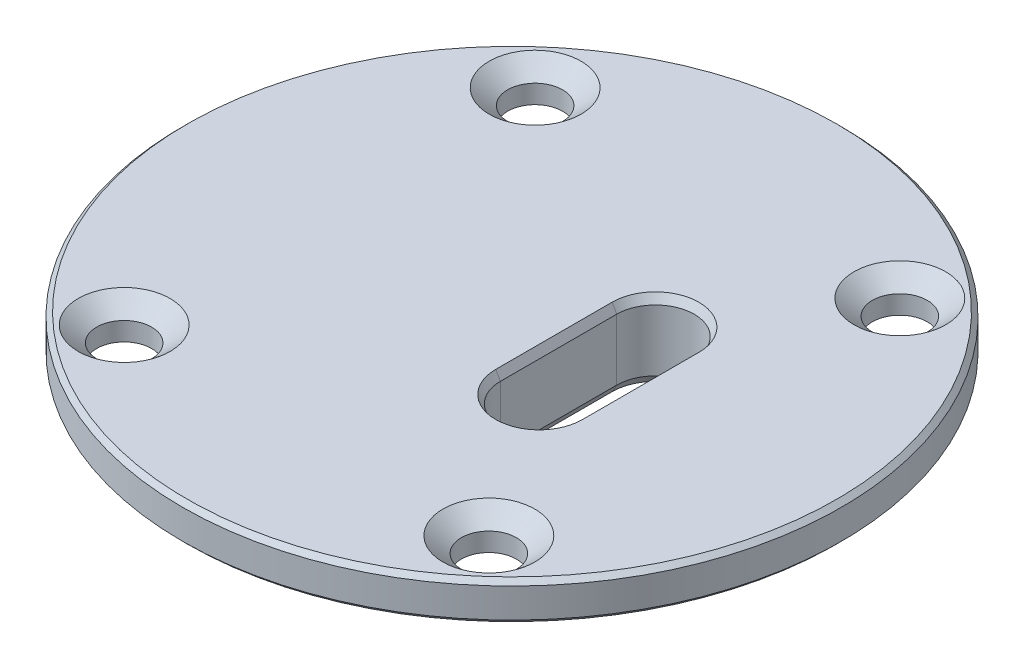
from build123d import *
from OCP.BRepFilletAPI import BRepFilletAPI_MakeChamfer

# Parameters (mm, degrees)
STOCK_DGT_START                               = 66.675
STOCK_DGT_INSIDE_SWERVE_STRUCTURE_SM_2_R      = 26.9875
STOCK_DGT_INSIDE_SWERVE_STRUCTURE_SM_2_R_2    = 2.2479
STOCK_DGT_INSIDE_SWERVE_STRUCTURE_SMALL_DEPTH = 3.175
STOCK_DGT_START_2                             = 63.5
STOCK_DGT_INSIDE_SWERVE_STRUCTURE_SM_3_O_R    = 15.875
STOCK_DGT_INSIDE_SWERVE_STRUCTURE_SM_3_DEPTH  = 3.175
SKETCH1_R                                     = 15.875
SKETCH1_R_2                                   = 15.621
CUT_EXTRUDE1_DEPTH                            = 3.175
FILLET1_R                                     = 0.635
CHAMFER1_SIZE                                 = 0.381
CHAMFER2_SIZE                                 = 0.381
CHAMFER2_SIZE2                                = 0.659911358
CHAMFER3_SIZE                                 = 1.27
CHAMFER3_SIZE2                                = 1.513527063


# Read off the part's stored shape, not the designer's step: Stock-DGT inside swerve structure Small Bearing-1
with BuildPart() as part:
    # Stock-DGT inside swerve structure Sm 2 → Stock-DGT inside swerve structure Small Bearing-1 (new body)
    with BuildSketch(Plane(origin=(0, 0, 0), x_dir=(1, 0, 0), z_dir=(0, 1, 0)).offset(STOCK_DGT_START)):
        Circle(STOCK_DGT_INSIDE_SWERVE_STRUCTURE_SM_2_R)
        with Locations((-14.933176064, -16.8275)):
            Circle(STOCK_DGT_INSIDE_SWERVE_STRUCTURE_SM_2_R_2, mode=Mode.SUBTRACT)
        with Locations((14.933176064, -16.8275)):
            Circle(STOCK_DGT_INSIDE_SWERVE_STRUCTURE_SM_2_R_2, mode=Mode.SUBTRACT)
        with Locations((-14.933176064, 16.8275)):
            Circle(STOCK_DGT_INSIDE_SWERVE_STRUCTURE_SM_2_R_2, mode=Mode.SUBTRACT)
        with Locations((14.933176064, 16.8275)):
            Circle(STOCK_DGT_INSIDE_SWERVE_STRUCTURE_SM_2_R_2, mode=Mode.SUBTRACT)
        with BuildLine():
            Line((3.81, -4.7625), (3.81, 4.7625))
            ThreePointArc((3.81, 4.7625), (6.985, 7.9375), (10.16, 4.7625))
            Line((10.16, 4.7625), (10.16, -4.7625))
            ThreePointArc((10.16, -4.7625), (6.985, -7.9375), (3.81, -4.7625))
        make_face(mode=Mode.SUBTRACT)
    extrude(amount=STOCK_DGT_INSIDE_SWERVE_STRUCTURE_SMALL_DEPTH)

    # Stock-DGT inside swerve structure Sm 3 o → Stock-DGT inside swerve structure Sm 3 (add)
    with BuildSketch(Plane(origin=(0, 0, 0), x_dir=(1, 0, 0), z_dir=(0, 1, 0)).offset(STOCK_DGT_START_2)):
        Circle(STOCK_DGT_INSIDE_SWERVE_STRUCTURE_SM_3_O_R)
        with BuildLine():
            ThreePointArc((10.16, -4.7625), (6.985, -7.9375), (3.81, -4.7625))
            Line((3.81, -4.7625), (3.81, 4.7625))
            ThreePointArc((3.81, 4.7625), (6.985, 7.9375), (10.16, 4.7625))
            Line((10.16, 4.7625), (10.16, -4.7625))
        make_face(mode=Mode.SUBTRACT)
    extrude(amount=STOCK_DGT_INSIDE_SWERVE_STRUCTURE_SM_3_DEPTH)

    # Sketch1 → Cut-Extrude1 (cut)
    with BuildSketch(Plane.XZ.offset(-63.5)):
        Circle(SKETCH1_R)
        with Locations(Location((0, 0, 0), (0, 0, 270))):
            Circle(SKETCH1_R_2, mode=Mode.SUBTRACT)
    extrude(amount=-CUT_EXTRUDE1_DEPTH, mode=Mode.SUBTRACT)

    # Fillet1
    fillet1_edges = [part.edges().sort_by_distance(p)[0] for p in [
        (0, 66.675, 15.621),
    ]]
    fillet(fillet1_edges, radius=FILLET1_R)

    # Chamfer1
    chamfer1_edges = [part.edges().sort_by_distance(p)[0] for p in [
        (-26.9875, 66.675, 0),
        (-26.9875, 69.85, 0),
        (0, 63.5, 15.621),
    ]]
    chamfer(chamfer1_edges, length=CHAMFER1_SIZE)

    # Chamfer2: one chamfer whose edges measure the first distance from different faces: ONE call of the kernel's chamfer builder (chamfer() names one face for all edges)
    chamfer2_edges_1 = [part.edges().sort_by_distance(p)[0] for p in [
        (-17.181076064, 66.675, -16.8275),
    ]]
    chamfer2_side_1 = [part.faces().sort_by_distance(p)[0] for p in [
        (-17.181076064, 68.2625, -16.8275),
    ]]
    chamfer2_edges_2 = [part.edges().sort_by_distance(p)[0] for p in [
        (-17.181076064, 66.675, 16.8275),
    ]]
    chamfer2_side_2 = [part.faces().sort_by_distance(p)[0] for p in [
        (-17.181076064, 68.2625, 16.8275),
    ]]
    chamfer2_edges_3 = [part.edges().sort_by_distance(p)[0] for p in [
        (10.16, 63.5, 0),
        (6.985, 63.5, -7.9375),
        (3.81, 63.5, 0),
        (6.985, 63.5, 7.9375),
    ]]
    chamfer2_side_3 = [part.faces().sort_by_distance(p)[0] for p in [
        (-1.009698226, 63.5, 0),
    ]]
    chamfer2_edges_4 = [part.edges().sort_by_distance(p)[0] for p in [
        (6.985, 69.85, 7.9375),
        (10.16, 69.85, 0),
        (6.985, 69.85, -7.9375),
        (3.81, 69.85, 0),
    ]]
    chamfer2_side_4 = [part.faces().sort_by_distance(p)[0] for p in [
        (-0.311216165, 69.85, 0),
    ]]
    chamfer2_edges_5 = [part.edges().sort_by_distance(p)[0] for p in [
        (12.685276064, 66.675, 16.8275),
    ]]
    chamfer2_side_5 = [part.faces().sort_by_distance(p)[0] for p in [
        (12.685276064, 68.2625, 16.8275),
    ]]
    chamfer2_edges_6 = [part.edges().sort_by_distance(p)[0] for p in [
        (12.685276064, 66.675, -16.8275),
    ]]
    chamfer2_side_6 = [part.faces().sort_by_distance(p)[0] for p in [
        (12.685276064, 68.2625, -16.8275),
    ]]
    chamfer2 = BRepFilletAPI_MakeChamfer(part.part.solid().wrapped)
    for e in chamfer2_edges_1:
        chamfer2.Add(CHAMFER2_SIZE, CHAMFER2_SIZE2, e.wrapped, chamfer2_side_1[0].wrapped)  # the first distance lies on this face
    for e in chamfer2_edges_2:
        chamfer2.Add(CHAMFER2_SIZE, CHAMFER2_SIZE2, e.wrapped, chamfer2_side_2[0].wrapped)  # the first distance lies on this face
    for e in chamfer2_edges_3:
        chamfer2.Add(CHAMFER2_SIZE, CHAMFER2_SIZE2, e.wrapped, chamfer2_side_3[0].wrapped)  # the first distance lies on this face
    for e in chamfer2_edges_4:
        chamfer2.Add(CHAMFER2_SIZE, CHAMFER2_SIZE2, e.wrapped, chamfer2_side_4[0].wrapped)  # the first distance lies on this face
    for e in chamfer2_edges_5:
        chamfer2.Add(CHAMFER2_SIZE, CHAMFER2_SIZE2, e.wrapped, chamfer2_side_5[0].wrapped)  # the first distance lies on this face
    for e in chamfer2_edges_6:
        chamfer2.Add(CHAMFER2_SIZE, CHAMFER2_SIZE2, e.wrapped, chamfer2_side_6[0].wrapped)  # the first distance lies on this face
    add(Compound.cast(chamfer2.Shape()), mode=Mode.REPLACE)

    # Chamfer3: one chamfer whose edges measure the first distance from different faces: ONE call of the kernel's chamfer builder (chamfer() names one face for all edges)
    chamfer3_edges_1 = [part.edges().sort_by_distance(p)[0] for p in [
        (-17.181076064, 69.85, -16.8275),
    ]]
    chamfer3_side_1 = [part.faces().sort_by_distance(p)[0] for p in [
        (-17.181076064, 68.453, -16.8275),
    ]]
    chamfer3_edges_2 = [part.edges().sort_by_distance(p)[0] for p in [
        (-17.181076064, 69.85, 16.8275),
    ]]
    chamfer3_side_2 = [part.faces().sort_by_distance(p)[0] for p in [
        (-17.181076064, 68.453, 16.8275),
    ]]
    chamfer3_edges_3 = [part.edges().sort_by_distance(p)[0] for p in [
        (12.685276064, 69.85, 16.8275),
    ]]
    chamfer3_side_3 = [part.faces().sort_by_distance(p)[0] for p in [
        (12.685276064, 68.453, 16.8275),
    ]]
    chamfer3_edges_4 = [part.edges().sort_by_distance(p)[0] for p in [
        (12.685276064, 69.85, -16.8275),
    ]]
    chamfer3_side_4 = [part.faces().sort_by_distance(p)[0] for p in [
        (12.685276064, 68.453, -16.8275),
    ]]
    chamfer3 = BRepFilletAPI_MakeChamfer(part.part.solid().wrapped)
    for e in chamfer3_edges_1:
        chamfer3.Add(CHAMFER3_SIZE, CHAMFER3_SIZE2, e.wrapped, chamfer3_side_1[0].wrapped)  # the first distance lies on this face
    for e in chamfer3_edges_2:
        chamfer3.Add(CHAMFER3_SIZE, CHAMFER3_SIZE2, e.wrapped, chamfer3_side_2[0].wrapped)  # the first distance lies on this face
    for e in chamfer3_edges_3:
        chamfer3.Add(CHAMFER3_SIZE, CHAMFER3_SIZE2, e.wrapped, chamfer3_side_3[0].wrapped)  # the first distance lies on this face
    for e in chamfer3_edges_4:
        chamfer3.Add(CHAMFER3_SIZE, CHAMFER3_SIZE2, e.wrapped, chamfer3_side_4[0].wrapped)  # the first distance lies on this face
    add(Compound.cast(chamfer3.Shape()), mode=Mode.REPLACE)


solid = part.part
